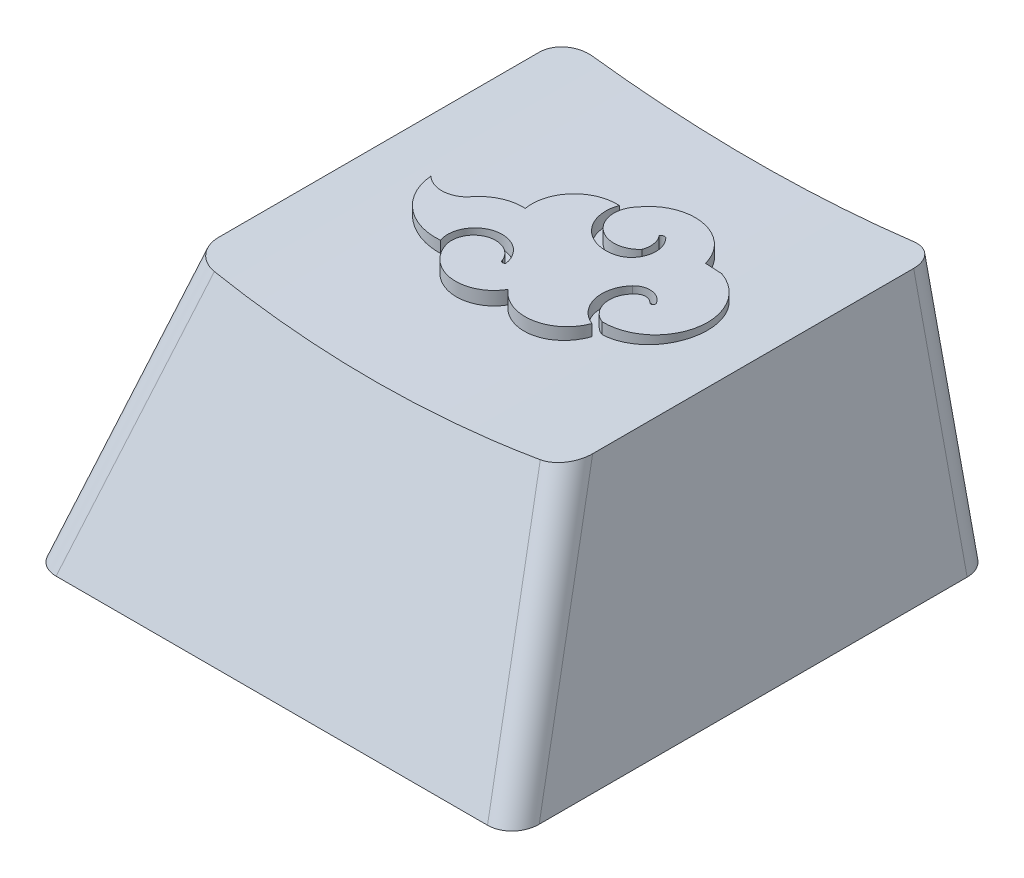
from build123d import *

# Parameters (mm, degrees)
BOSS_EXTRUDE1_DEPTH = 1
BOSS_EXTRUDE2_START = -1
BOSS_EXTRUDE2_DEPTH = 8
CUT_EXTRUDE1_DEPTH  = 18
FILLET2_R           = 1
BOSS_EXTRUDE3_START = 8
BOSS_EXTRUDE3_DEPTH = 1


with BuildPart() as part:
    # Sketch1 → Loft2 section 0
    with BuildSketch(Plane(origin=(0, 0, 0), x_dir=(1, 0, 0), z_dir=(0, 1, 0))):
        with BuildLine():
            Line((9, -9), (-9, -9))
            Line((-9, -9), (-9, 9))
            Line((-9, 9), (9, 9))
            Line((9, 9), (9, -9))
        make_face()
    # Sketch3 → Loft2 section 1
    with BuildSketch(Plane(origin=(0, 9, 0), x_dir=(1, 0, 0), z_dir=(0, 1, 0))):
        with BuildLine():
            Line((0, 9), (-7, 9))
            Line((-7, 9), (-7, -5))
            Line((-7, -5), (7, -5))
            Line((7, -5), (7, 9))
            Line((7, 9), (0, 9))
        make_face()
    loft()

    # Cut-Loft3: read off the stored shape, not the designer's step
    # Cut-Loft3: loft between two sections, ruled curve by curve
    cut_loft3_from = [
        Edge.make_line((8, 0, -8), (8, 0, 8)),
        Edge.make_line((-8, 0, -8), (8, 0, -8)),
        Edge.make_line((-8, 0, 8), (-8, 0, -8)),
        Edge.make_line((8, 0, 8), (-8, 0, 8)),
    ]
    cut_loft3_to = [
        Edge.make_line((6, 9, -8), (6, 9, 4)),
        Edge.make_line((-6, 9, -8), (6, 9, -8)),
        Edge.make_line((-6, 9, 4), (-6, 9, -8)),
        Edge.make_line((6, 9, 4), (-6, 9, 4)),
    ]
    cut_loft3 = Solid(Shell([*[Face.make_surface_from_curves(cut_loft3_from[k], cut_loft3_to[k]) for k in range(4)], Face(Wire(cut_loft3_from)), Face(Wire(cut_loft3_to))]))
    add(cut_loft3, mode=Mode.SUBTRACT)

    # Sketch3<8> → Boss-Extrude1 (add)
    with BuildSketch(Plane(origin=(0, 9, 0), x_dir=(1, 0, 0), z_dir=(0, 1, 0))):
        Polygon((0, 9), (-7, 9), (-7, -5), (7, -5), (7, 9), align=None)
    extrude(amount=-BOSS_EXTRUDE1_DEPTH)

    # Sketch9 → Boss-Extrude2 (add)
    with BuildSketch(Plane(origin=(0, 9, 0), x_dir=(1, 0, 0), z_dir=(0, 1, 0)).offset(BOSS_EXTRUDE2_START)):
        with BuildLine():
            ThreePointArc((2.5, 2), (1.767766953, 3.767766953), (0, 4.5))
            Line((0, 4.5), (0, 4))
            ThreePointArc((0, 4), (0.252008585, 3.984059393), (0.5, 3.936491673))
            ThreePointArc((0.5, 3.936491673), (1.414213562, 3.414213562), (1.936491673, 2.5))
            ThreePointArc((1.936491673, 2.5), (1.984059393, 2.252008585), (2, 2))
            ThreePointArc((2, 2), (1.984059393, 1.747991415), (1.936491673, 1.5))
            ThreePointArc((1.936491673, 1.5), (1.414213562, 0.585786438), (0.5, 0.063508327))
            ThreePointArc((0.5, 0.063508327), (0.252008585, 0.015940607), (0, 0))
            Line((0, 0), (0, -0.5))
            ThreePointArc((0, -0.5), (1.767766953, 0.232233047), (2.5, 2))
        make_face()
        with BuildLine():
            Line((0, 4), (0, 4.5))
            ThreePointArc((0, 4.5), (-2.5, 2), (0, -0.5))
            Line((0, -0.5), (0, 0))
            ThreePointArc((0, 0), (-0.252008585, 0.015940607), (-0.5, 0.063508327))
            ThreePointArc((-0.5, 0.063508327), (-1.414213562, 0.585786438), (-1.936491673, 1.5))
            ThreePointArc((-1.936491673, 1.5), (-2, 2), (-1.936491673, 2.5))
            ThreePointArc((-1.936491673, 2.5), (-1.414213562, 3.414213562), (-0.5, 3.936491673))
            ThreePointArc((-0.5, 3.936491673), (-0.252008585, 3.984059393), (0, 4))
        make_face()
        with BuildLine():
            Line((-0.5, 2.5), (-0.5, 3.936491673))
            ThreePointArc((-0.5, 3.936491673), (-1.414213562, 3.414213562), (-1.936491673, 2.5))
            Line((-1.936491673, 2.5), (-0.5, 2.5))
        make_face()
        with BuildLine():
            ThreePointArc((1.936491673, 2.5), (1.414213562, 3.414213562), (0.5, 3.936491673))
            Line((0.5, 3.936491673), (0.5, 2.5))
            Line((0.5, 2.5), (1.936491673, 2.5))
        make_face()
        with BuildLine():
            Line((0.5, 1.5), (0.5, 0.063508327))
            ThreePointArc((0.5, 0.063508327), (1.414213562, 0.585786438), (1.936491673, 1.5))
            Line((1.936491673, 1.5), (0.5, 1.5))
        make_face()
        with BuildLine():
            ThreePointArc((-1.936491673, 1.5), (-1.414213562, 0.585786438), (-0.5, 0.063508327))
            Line((-0.5, 0.063508327), (-0.5, 1.5))
            Line((-0.5, 1.5), (-1.936491673, 1.5))
        make_face()
    extrude(amount=-BOSS_EXTRUDE2_DEPTH)

    # Sketch10 → Cut-Extrude1 (cut)
    with BuildSketch(Plane(origin=(0, 0, -9), x_dir=(-1, 0, 0), z_dir=(0, 0, -1))):
        with BuildLine():
            Line((-7, 9), (7, 9))
            ThreePointArc((7, 9), (0, 8.4960195), (-7, 9))
        make_face()
    extrude(amount=-CUT_EXTRUDE1_DEPTH, mode=Mode.SUBTRACT)

    # Fillet2
    fillet2_edges = [part.edges().sort_by_distance(p)[0] for p in [
        (-8, 4.5, -9),
        (8, 4.5, -9),
        (8, 4.5, 7),
        (-8, 4.5, 7),
    ]]
    fillet(fillet2_edges, radius=FILLET2_R)

    # Sketch12 → Boss-Extrude3 (add)
    with BuildSketch(Plane(origin=(0, 0, 0), x_dir=(1, 0, 0), z_dir=(0, 1, 0)).offset(BOSS_EXTRUDE3_START)):
        with BuildLine():
            Line((3.581786245, 4.240596222), (2.945334125, 4.272419097))
            ThreePointArc((2.945334125, 4.272419097), (1.580068464, 5.534847266), (-0.142959574, 4.835669471))
            ThreePointArc((-0.142959574, 4.835669471), (-0.072742065, 3.461690437), (1.301236968, 3.531907946))
            ThreePointArc((1.301236968, 3.531907946), (1.344877857, 3.934460155), (1.181086076, 4.304764166))
            ThreePointArc((1.181086076, 4.304764166), (1.26486543, 4.372930475), (1.372307239, 4.361890385))
            ThreePointArc((1.372307239, 4.361890385), (1.623671348, 3.567376067), (1.121377086, 2.902441943))
            ThreePointArc((1.121377086, 2.902441943), (-0.231414775, 3.184828144), (-0.539737114, 4.531945481))
            ThreePointArc((-0.539737114, 4.531945481), (-1.819279995, 4.009007276), (-2.205376195, 2.681745404))
            ThreePointArc((-2.205376195, 2.681745404), (-3.016060665, 2.51631725), (-3.646364404, 1.980320066))
            ThreePointArc((-3.646364404, 1.980320066), (-4.327119044, 1.689455161), (-5.014157813, 1.965148837))
            ThreePointArc((-5.014157813, 1.965148837), (-4.281658635, 0.548246446), (-2.76180221, 0.064300293))
            ThreePointArc((-2.76180221, 0.064300293), (-2.037336191, 1.379203145), (-0.787003641, 0.548246446))
            ThreePointArc((-0.787003641, 0.548246446), (-0.886204145, 0.498401478), (-0.957055057, 0.583873164))
            ThreePointArc((-0.957055057, 0.583873164), (-2.00225835, 1.042077327), (-2.507207587, 0.018638396))
            ThreePointArc((-2.507207587, 0.018638396), (-1.297421649, -0.973910564), (0.096724797, -0.26321292))
            ThreePointArc((0.096724797, -0.26321292), (1.566904433, -0.806570536), (2.770449564, 0.197493596))
            ThreePointArc((2.770449564, 0.197493596), (2.019360199, 1.069566472), (2.30803646, 2.183708451))
            ThreePointArc((2.30803646, 2.183708451), (2.838720645, 2.372686483), (3.312040204, 2.067224545))
            ThreePointArc((3.312040204, 2.067224545), (3.292128592, 1.945237225), (3.170141272, 1.965148837))
            ThreePointArc((3.170141272, 1.965148837), (2.944061172, 2.078913386), (2.697636855, 2.021210346))
            ThreePointArc((2.697636855, 2.021210346), (2.333692103, 1.174003789), (2.901024067, 0.447127475))
            ThreePointArc((2.901024067, 0.447127475), (4.865037055, 2.052490742), (3.581786245, 4.240596222))
        make_face()
    extrude(amount=BOSS_EXTRUDE3_DEPTH)


solid = part.part
